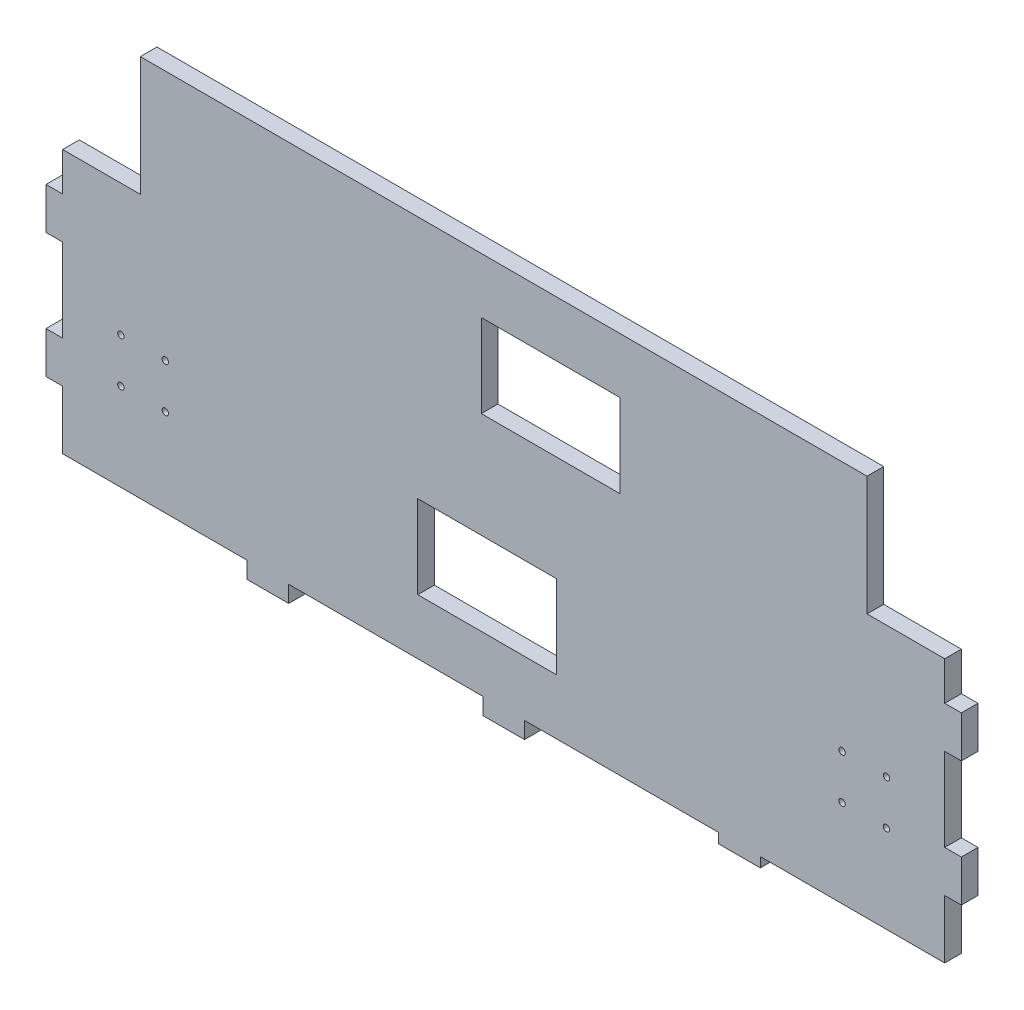
from build123d import *

# Parameters (mm, degrees)
ESQUISSE1_W             = 50
ESQUISSE1_H             = 30
BOSS_EXTRU_1_DEPTH      = 6
ESQUISSE2_W             = 15
ESQUISSE2_H             = 6
ESQUISSE2_H_2           = 3.553464957
ESQUISSE2_W_2           = 6
ESQUISSE2_H_3           = 15
BOSS_EXTRU_2_DEPTH      = 6
ESQUISSE3_R             = 1.15
ENL_V_MAT_EXTRU_1_DEPTH = 6


with BuildPart() as part:
    # Esquisse1 → Boss.-Extru.1 (new body)
    with BuildSketch(Plane.XY):
        Polygon((-159, 35), (-131, 35), (-131, 78), (131, 78), (131, 35), (159, 35), (159, -60), (-159, -60), align=None)
        with Locations((-6, -25)):
            Rectangle(ESQUISSE1_W, ESQUISSE1_H, mode=Mode.SUBTRACT)
        with Locations((16.916466651, 43)):
            Rectangle(ESQUISSE1_W, ESQUISSE1_H, mode=Mode.SUBTRACT)
    extrude(amount=BOSS_EXTRU_1_DEPTH)

    # Esquisse2 → Boss.-Extru.2 (add)
    with BuildSketch(Plane.XY.offset(6)):
        with Locations((-85, -63)):
            Rectangle(ESQUISSE2_W, ESQUISSE2_H)
        with Locations((0, -63)):
            Rectangle(ESQUISSE2_W, ESQUISSE2_H)
        with Locations((85, -61.776732479)):
            Rectangle(ESQUISSE2_W, ESQUISSE2_H_2)
        with Locations((-162, 13.59)):
            Rectangle(ESQUISSE2_W_2, ESQUISSE2_H_3)
        with Locations((-162, -31.41)):
            Rectangle(ESQUISSE2_W_2, ESQUISSE2_H_3)
        with Locations((162, -31.41)):
            Rectangle(ESQUISSE2_W_2, ESQUISSE2_H_3)
        with Locations((162, 13.59)):
            Rectangle(ESQUISSE2_W_2, ESQUISSE2_H_3)
    extrude(amount=-BOSS_EXTRU_2_DEPTH)

    # Esquisse3 → Enlèv. mat.-Extru.1 (cut)
    with BuildSketch(Plane(origin=(0, 0, 0), x_dir=(-1, 0, 0), z_dir=(0, 0, -1))):
        with Locations((138, -28.38)):
            Circle(ESQUISSE3_R)
        with Locations((138, -12.38)):
            Circle(ESQUISSE3_R)
        with Locations((122, -12.38)):
            Circle(ESQUISSE3_R)
        with Locations((122, -28.38)):
            Circle(ESQUISSE3_R)
        with Locations((-122, -28.38)):
            Circle(ESQUISSE3_R)
        with Locations((-122, -12.38)):
            Circle(ESQUISSE3_R)
        with Locations((-138, -12.38)):
            Circle(ESQUISSE3_R)
        with Locations((-138, -28.38)):
            Circle(ESQUISSE3_R)
    extrude(amount=-ENL_V_MAT_EXTRU_1_DEPTH, mode=Mode.SUBTRACT)


solid = part.part
